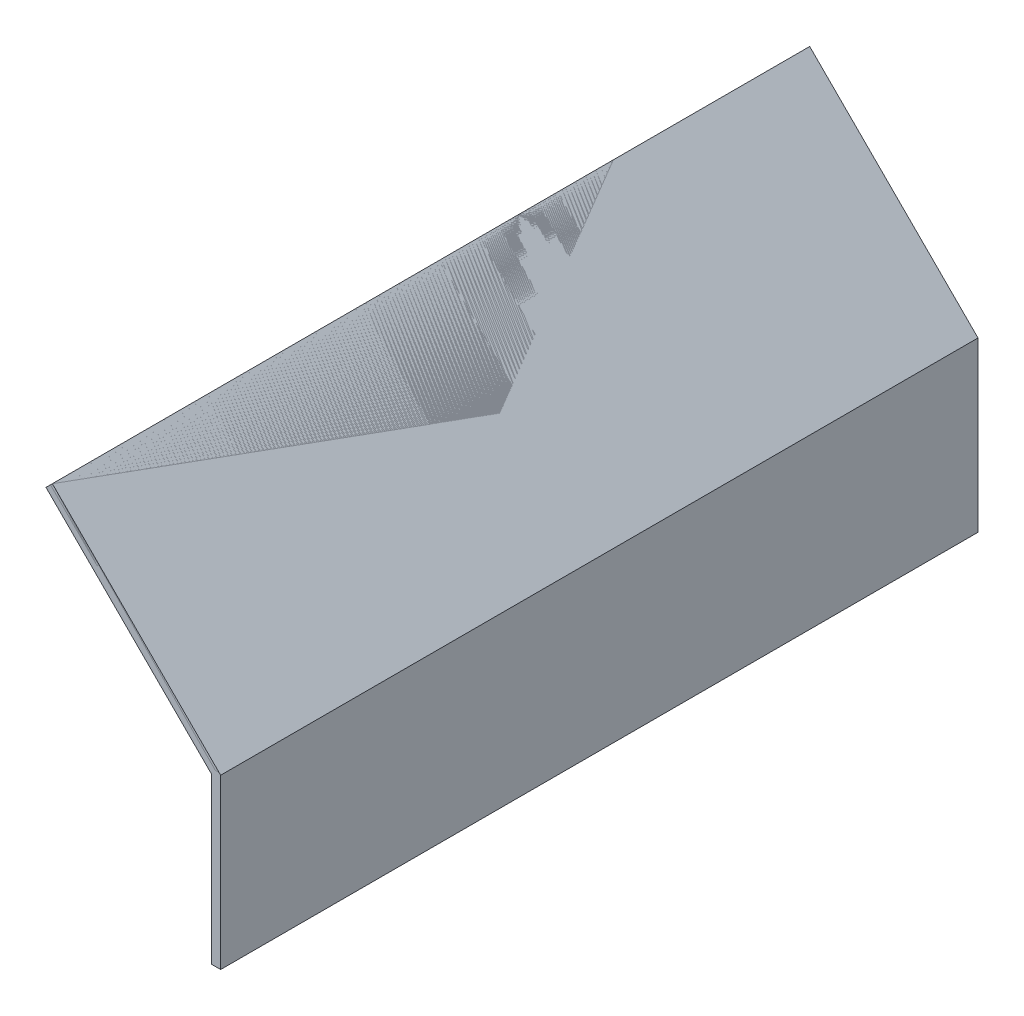
from build123d import *

# Parameters (mm, degrees)
BOSS_EXTRUDE2_DEPTH  = 342.9
CONVERT_SOLID2_START = -342.9
CONVERT_SOLID2_DEPTH = 342.9
SKETCH12_W           = 73.025
SKETCH12_H           = 76.927581903
CUT_EXTRUDE1_DEPTH   = 292.1
SKETCH13_W           = 85.725
SKETCH13_H           = 76.927581903
CUT_EXTRUDE2_DEPTH   = 292.1
SKETCH14_R           = 3.2639
CUT_EXTRUDE3_DEPTH   = 292.1
SKETCH18_W           = 50.8
SKETCH18_H           = 76.927581903
CUT_EXTRUDE4_DEPTH   = 439.772530417
SKETCH21_W           = 63.5
SKETCH21_H           = 100.852216804
CUT_EXTRUDE11_DEPTH  = 439.772530417
SKETCH22_W           = 25.4
SKETCH22_H           = 168.264198316
CUT_EXTRUDE13_DEPTH  = 439.772530417


# Read off the part's stored shape, not the designer's step: Convert-Solid2
with BuildPart() as part:
    # Sketch7 → Boss-Extrude2 (new body)
    with BuildSketch(Plane.XY):
        Polygon((0, 0), (4.064, 0), (4.064, 76.2), (-72.136, 152.4), (-75.009681959, 149.526318041), (-74.603697881, 149.120333963), (0, 74.516636083), align=None)
    extrude(amount=-BOSS_EXTRUDE2_DEPTH)


with BuildPart() as body_2:
    # Convert-Solid2 outline → Convert-Solid2 (new body)
    with BuildSketch(Plane.XY.offset(CONVERT_SOLID2_START)):
        with BuildLine():
            Line((2.84988, 0), (4.064, 0))
            Line((4.064, 0), (4.064, 75.171043805))
            ThreePointArc((4.064, 75.171043805), (3.874907624, 76.121675373), (3.336418097, 76.927581903))
            Line((3.336418097, 76.927581903), (-72.136, 152.4))
            Line((-72.136, 152.4), (-72.994512485, 151.541487515))
            Line((-72.994512485, 151.541487515), (2.477905612, 76.069069418))
            ThreePointArc((2.477905612, 76.069069418), (2.753207006, 75.657051765), (2.84988, 75.171043805))
            Line((2.84988, 75.171043805), (2.84988, 0))
        make_face()
    extrude(amount=CONVERT_SOLID2_DEPTH)

    # Sketch12 → Cut-Extrude1 (cut)
    with BuildSketch(Plane(origin=(152.4, 0, 0), x_dir=(0, 0, -1), z_dir=(1, 0, 0))):
        with Locations((36.5125, 38.463790952)):
            Rectangle(SKETCH12_W, SKETCH12_H)
    extrude(amount=-CUT_EXTRUDE1_DEPTH, mode=Mode.SUBTRACT)

    # Sketch13 → Cut-Extrude2 (cut)
    with BuildSketch(Plane(origin=(152.4, 0, 0), x_dir=(0, 0, -1), z_dir=(1, 0, 0))):
        with Locations((249.2375, 38.463790952)):
            Rectangle(SKETCH13_W, SKETCH13_H)
    extrude(amount=-CUT_EXTRUDE2_DEPTH, mode=Mode.SUBTRACT)

    # Sketch14 → Cut-Extrude3 (cut)
    with BuildSketch(Plane.ZY.offset(-2.84988)):
        with Locations(Location((-193.675, 12.7, 0), (0, 0, 270))):
            Circle(SKETCH14_R)
        with Locations(Location((-85.725, 12.7, 0), (0, 0, 270))):
            Circle(SKETCH14_R)
    extrude(amount=-CUT_EXTRUDE3_DEPTH, mode=Mode.SUBTRACT)

    # Sketch18 → Cut-Extrude4 (cut, through all)
    with BuildSketch(Plane(origin=(152.4, 0, 0), x_dir=(0, 0, -1), z_dir=(1, 0, 0))):
        with Locations((317.5, 38.463790952)):
            Rectangle(SKETCH18_W, SKETCH18_H)
    extrude(amount=-CUT_EXTRUDE4_DEPTH, mode=Mode.SUBTRACT)

    # Sketch21 → Cut-Extrude11 (cut, through all)
    with BuildSketch(Plane(origin=(152.4, 0, 0), x_dir=(0, 0, -1), z_dir=(1, 0, 0))):
        with Locations((311.15, 127.353690305)):
            Rectangle(SKETCH21_W, SKETCH21_H)
    extrude(amount=-CUT_EXTRUDE11_DEPTH, mode=Mode.SUBTRACT)

    # Sketch22 → Cut-Extrude13 (cut, through all)
    with BuildSketch(Plane(origin=(152.4, 0, 0), x_dir=(0, 0, -1), z_dir=(1, 0, 0))):
        with Locations((266.7, 68.267900842)):
            Rectangle(SKETCH22_W, SKETCH22_H)
    extrude(amount=-CUT_EXTRUDE13_DEPTH, mode=Mode.SUBTRACT)


solid = Compound([part.part, body_2.part])
